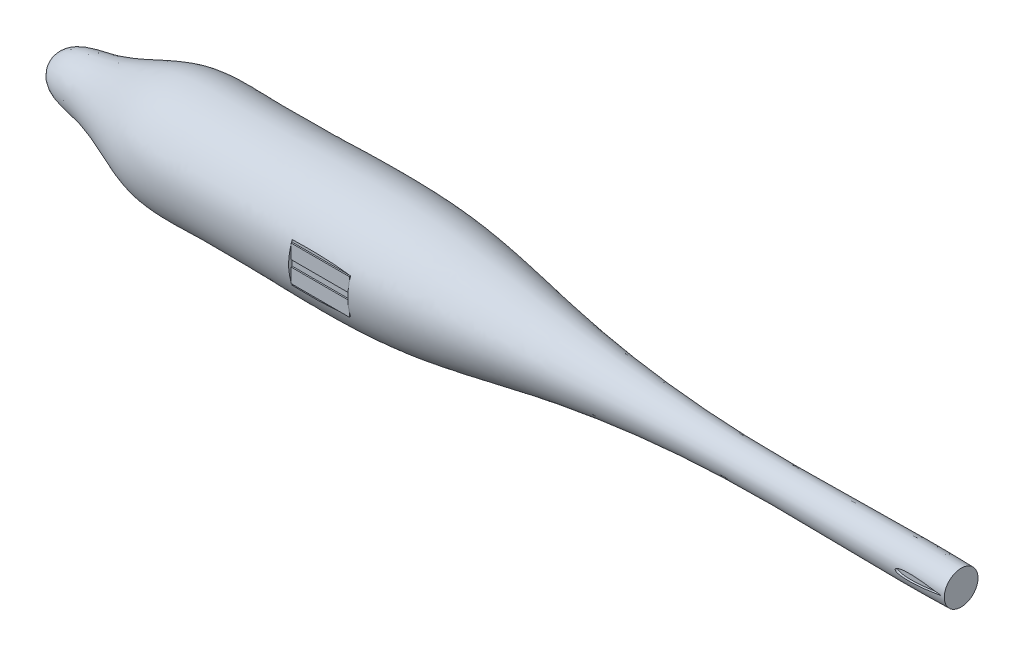
from build123d import *

# Parameters (mm, degrees)
SKETCH5_W           = 90
SKETCH5_H           = 200
CUT_EXTRUDE4_DEPTH  = 6.5
SKETCH8_W           = 90
SKETCH8_H           = 22.045196906
BOSS_EXTRUDE1_DEPTH = 2
CUT_EXTRUDE7_DEPTH  = 65


with BuildPart() as part:
    # Sketch1 → Revolve2 (revolve)
    with BuildSketch(Plane.XY):
        with BuildLine():
            Line((1400, 0), (1400, 25.997014576))
            add(Edge.make_bspline(
                [(0, 0), (6.007862839, 35.12054136), (87.570445438, 35.979993634), (174.285504865, 89.884927882), (355.229810131, 80.463468301), (551.199038272, 98.190296267), (802.566829119, 43.065619564), (1072.41205954, 17.747902618), (1281.149711777, 28.859320036), (1400, 25.997014576)],
                knots=[0, 0, 0, 0, 0.060908752, 0.147322495, 0.213188607, 0.431416814, 0.561861324, 0.750119802, 1, 1, 1, 1], degree=3))
            Line((0, 0), (12.886919121, 0))
            add(Edge.make_bspline(
                [(12.886919121, 0), (12.270156115, 24.123714505), (42.007067461, 17.590419325), (77.154769747, 41.215851536), (129.16776949, 36.162803827), (178.755437558, 69.083127404), (233.990826608, 66.71089051), (368.450574642, 69.099852472), (548.636953824, 76.370908644), (801.020611052, 37.171244122), (1065.85489257, -5.420045309), (1273.601038578, 25.806400648), (1388.531968159, 14.959996524)],
                knots=[0, 0, 0, 0, 0.033016172, 0.050941874, 0.089125016, 0.137759658, 0.171792279, 0.205000789, 0.427814055, 0.555409907, 0.752933693, 1, 1, 1, 1], degree=3))
            Line((1388.531968159, 14.959996524), (1387.120144827, 0))
            Line((1387.120144827, 0), (1400, 0))
        make_face()
    revolve(axis=Axis((0, 0, 0), (1, 0, 0)))

    # Sketch5 → Cut-Extrude4 (cut)
    with BuildSketch(Plane.XY.offset(88)):
        with Locations((495, 0)):
            Rectangle(SKETCH5_W, SKETCH5_H)
    extrude(amount=-CUT_EXTRUDE4_DEPTH, mode=Mode.SUBTRACT)

    # Sketch8 → Boss-Extrude1 (add)
    with BuildSketch(Plane.XY.offset(81.5)):
        with Locations((495, 16.022598453)):
            Rectangle(SKETCH8_W, SKETCH8_H)
        with Locations((495, -16.022598453)):
            Rectangle(SKETCH8_W, SKETCH8_H)
    extrude(amount=BOSS_EXTRUDE1_DEPTH)

    # Sketch14 → Cut-Extrude7 (cut)
    with BuildSketch(Plane.XY.offset(88)):
        with BuildLine():
            Line((1395, 0.1106), (1395, -0.1106))
            add(Edge.make_bspline(
                [(1395, 0.1106), (1393.833719765, 0.311248034), (1391.502958358, 0.71223459), (1386.838701983, 1.457697445), (1381.007945313, 2.313489836), (1374.007359143, 3.225234898), (1367.007451257, 4.016115554), (1360.007467218, 4.662521544), (1353.00637342, 5.121735703), (1347.167337009, 5.283386722), (1342.498027895, 5.219716763), (1338.994113971, 5.046557174), (1335.48539919, 4.713356984), (1332.564294915, 4.246864191), (1330.231412395, 3.692167034), (1328.460126262, 3.135915045), (1326.971024707, 2.460799027), (1325.634330615, 1.567456435), (1324.597415043, 0), (1325.634330615, -1.567456435), (1326.971024707, -2.460799027), (1328.460126262, -3.135915045), (1330.231412395, -3.692167034), (1332.564294915, -4.246864191), (1335.48539919, -4.713356984), (1338.994113971, -5.046557174), (1342.498027895, -5.219716763), (1347.167337009, -5.283386722), (1353.00637342, -5.121735703), (1360.007467218, -4.662521544), (1367.007451257, -4.016115554), (1374.007359143, -3.225234898), (1381.007945313, -2.313489836), (1386.838701983, -1.457697445), (1391.502958358, -0.71223459), (1393.833719765, -0.311248034), (1395, -0.1106)],
                knots=[0, 0, 0, 0, 0.024684023, 0.04932997, 0.098522081, 0.147602022, 0.196578276, 0.24545048, 0.2942189, 0.342903642, 0.367241268, 0.391607784, 0.416059249, 0.440726349, 0.453242725, 0.466028387, 0.479472724, 0.486972137, 0.5, 0.513027863, 0.520527276, 0.533971613, 0.546757275, 0.559273651, 0.583940751, 0.608392216, 0.632758732, 0.657096358, 0.7057811, 0.75454952, 0.803421724, 0.852397978, 0.901477919, 0.95067003, 0.975315977, 1, 1, 1, 1], degree=3))
        make_face()
    extrude(amount=-CUT_EXTRUDE7_DEPTH, mode=Mode.SUBTRACT)


solid = part.part
